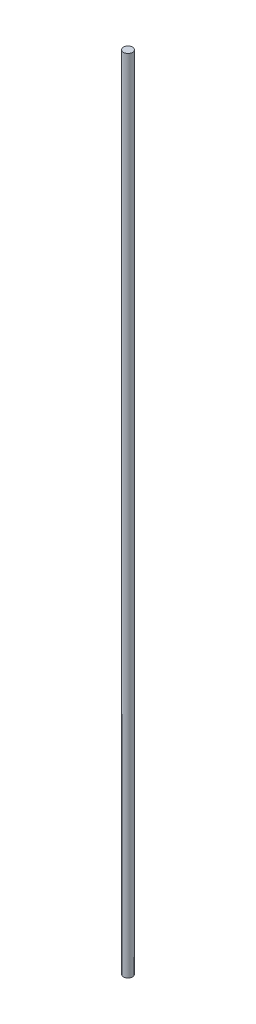
from build123d import *

# Parameters (mm, degrees)
SKETCH_1_R      = 1
EXTRUDE_1_DEPTH = 175


with BuildPart() as part:
    # 草图1 → 凸台-拉伸1 (new body)
    with BuildSketch(Plane(origin=(0, 0, 0), x_dir=(1, 0, 0), z_dir=(0, 1, 0))):
        Circle(SKETCH_1_R)
    extrude(amount=EXTRUDE_1_DEPTH)


solid = part.part
